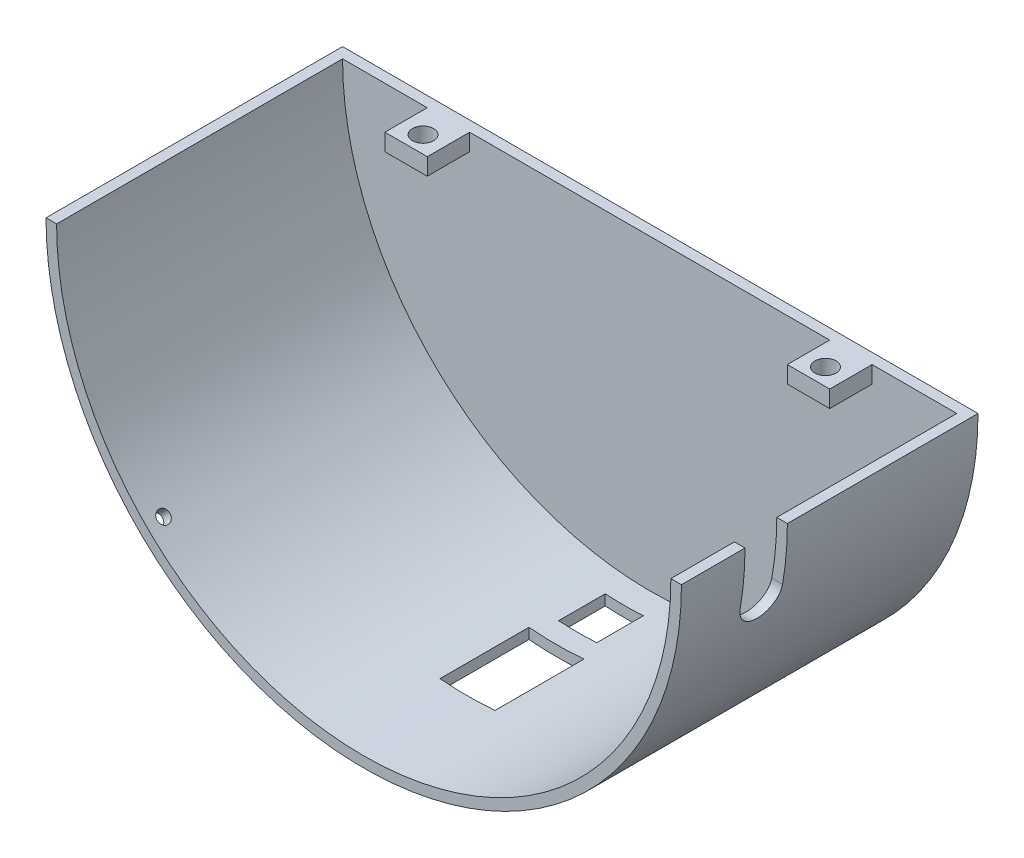
from build123d import *

# Parameters (mm, degrees)
SZKIC1_R                         = 75
DODANIE_WYCI_GNI_CIE1_DEPTH      = 70
SKORUPA1_T                       = -2.5
SZKIC3_W                         = 13
SZKIC3_H                         = 21
WYTNIJ_WYCI_GNI_CIE1_DEPTH       = 60
SZKIC4_W                         = 9
SZKIC4_H                         = 11
WYTNIJ_WYCI_GNI_CIE2_DEPTH       = 60
DODANIE_WYCI_GNI_CIE2_REACH      = 192.066
DODANIE_WYCI_GNI_CIE2_END_RADIUS = 75
SZKIC7_W                         = 60
SZKIC7_H                         = 35
SZKIC8_W                         = 45.5
SZKIC8_H                         = 26.5
WYTNIJ_WYCI_GNI_CIE4_DEPTH       = 30
ZAOKR_GLENIE1_R                  = 5
WYTNIJ_WYCI_GNI_CIE5_DEPTH       = 14
SZKIC10_R                        = 1.5
WYTNIJ_WYCI_GNI_CIE6_DEPTH       = 10
SZYK_KO_OWY1_COUNT               = 4
PRZECI_CIE2_OUTLINE_W            = 152
PRZECI_CIE2_OUTLINE_H            = 70
PRZECI_CIE2_OUTLINE_W_2          = 45.5
PRZECI_CIE2_OUTLINE_H_2          = 26.5
PRZECI_CIE2_DEPTH                = 85
SZKIC11_W                        = 10
SZKIC11_H                        = 10
SZKIC11_R                        = 2.5
DODANIE_WYCI_GNI_CIE3_DEPTH      = 4


# Read off the part's stored shape, not the designer's step: Przecięcie2
with BuildPart() as part:
    # Szkic1 → Dodanie-wyciągnięcie1 (new body)
    with BuildSketch(Plane.XY):
        Circle(SZKIC1_R)
    extrude(amount=DODANIE_WYCI_GNI_CIE1_DEPTH)

    # Skorupa1
    skorupa1_openings = [part.faces().sort_by_distance(p)[0] for p in [
        (0, 0, 70),
    ]]
    offset(amount=SKORUPA1_T, openings=skorupa1_openings, kind=Kind.INTERSECTION)

    # Szkic3 → Wytnij-wyciągnięcie1 (cut)
    with BuildSketch(Plane(origin=(0, -75, 0), x_dir=(-1, 0, 0), z_dir=(0, -1, 0))):
        with Locations((0, -35)):
            Rectangle(SZKIC3_W, SZKIC3_H)
    extrude(amount=-WYTNIJ_WYCI_GNI_CIE1_DEPTH, mode=Mode.SUBTRACT)

    # Szkic4 → Wytnij-wyciągnięcie2 (cut)
    with BuildSketch(Plane(origin=(0, -75, 0), x_dir=(-1, 0, 0), z_dir=(0, -1, 0))):
        with Locations((0, -14)):
            Rectangle(SZKIC4_W, SZKIC4_H)
    extrude(amount=-WYTNIJ_WYCI_GNI_CIE2_DEPTH, mode=Mode.SUBTRACT)

    # Dodanie-wyciągnięcie2: up to this cylinder (the profile starts outside it)
    dodanie_wyci_gni_cie2_end = Plane(origin=(0, 0, 35.532003), z_dir=(0, 0, -1)) * Cylinder(DODANIE_WYCI_GNI_CIE2_END_RADIUS, 535.132, mode=Mode.PRIVATE)
    # Szkic7 → Dodanie-wyciągnięcie2 (add, up to the surface)
    with BuildSketch(Plane(origin=(0, 85, 0), x_dir=(-1, 0, 0), z_dir=(0, -1, 0)), mode=Mode.PRIVATE) as dodanie_wyci_gni_cie2_sk1:
        with Locations((0, -35.532003496)):
            Rectangle(SZKIC7_W, SZKIC7_H)
    dodanie_wyci_gni_cie2_tool1 = extrude(dodanie_wyci_gni_cie2_sk1.sketch, amount=DODANIE_WYCI_GNI_CIE2_REACH, mode=Mode.PRIVATE) - dodanie_wyci_gni_cie2_end
    add(dodanie_wyci_gni_cie2_tool1.solids().sort_by_distance((0, 85, 35.532003))[0])

    # Szkic8 → Wytnij-wyciągnięcie4 (cut)
    with BuildSketch(Plane(origin=(0, 85, 0), x_dir=(1, 0, 0), z_dir=(0, 1, 0))):
        with Locations((0, -35.532003496)):
            Rectangle(SZKIC8_W, SZKIC8_H)
    extrude(amount=-WYTNIJ_WYCI_GNI_CIE4_DEPTH, mode=Mode.SUBTRACT)

    # Zaokrąglenie1
    zaokr_glenie1_edges = [part.edges().sort_by_distance(p)[0] for p in [
        (-30, 76.869317712, 18.032003496),
        (-30, 76.869317712, 53.032003496),
        (30, 76.869317712, 18.032003496),
        (30, 76.869317712, 53.032003496),
    ]]
    fillet(zaokr_glenie1_edges, radius=ZAOKR_GLENIE1_R)

    # Szkic9 → Wytnij-wyciągnięcie5 (cut)
    with BuildSketch(Plane(origin=(75, 0, 0), x_dir=(0, 0, -1), z_dir=(1, 0, 0))):
        with BuildLine():
            Line((-55, -12.979686846), (-55, 12.020313154))
            ThreePointArc((-55, 12.020313154), (-50, 17.020313154), (-45, 12.020313154))
            Line((-45, 12.020313154), (-45, -12.979686846))
            ThreePointArc((-45, -12.979686846), (-50, -17.979686846), (-55, -12.979686846))
        make_face()
    extrude(amount=-WYTNIJ_WYCI_GNI_CIE5_DEPTH, mode=Mode.SUBTRACT)

    # Szkic10 → Wytnij-wyciągnięcie6 (cut)
    with BuildSketch(Plane(origin=(53.033008589, 53.033008589, 0), x_dir=(0, 0, -1), z_dir=(0.7071067811865512, 0.7071067811865438, 0))):
        with Locations(Location((-66, 0, 0), (0, 0, 90))):
            Circle(SZKIC10_R)
    wytnij_wyci_gni_cie6 = extrude(amount=-WYTNIJ_WYCI_GNI_CIE6_DEPTH, mode=Mode.SUBTRACT)

    # Szyk kołowy1: Wytnij-wyciągnięcie6 ×4 about axis
    szyk_ko_owy1_axis = Axis((0, 0, 70), (0, 0, -1))
    for i in range(1, SZYK_KO_OWY1_COUNT):
        add(wytnij_wyci_gni_cie6.rotate(szyk_ko_owy1_axis, i * 360 / SZYK_KO_OWY1_COUNT), mode=Mode.SUBTRACT)

    # Przecięcie2 outline → Przecięcie2 (cut)
    with BuildSketch(Plane(origin=(0, 0, 0), x_dir=(1, 0, 0), z_dir=(0, 1, 0))):
        with Locations((0, -35)):
            Rectangle(PRZECI_CIE2_OUTLINE_W, PRZECI_CIE2_OUTLINE_H)
        with Locations((0, -35.532003496)):
            Rectangle(PRZECI_CIE2_OUTLINE_W_2, PRZECI_CIE2_OUTLINE_H_2, mode=Mode.SUBTRACT)
    extrude(amount=PRZECI_CIE2_DEPTH, mode=Mode.SUBTRACT)

    # Szkic11 → Dodanie-wyciągnięcie3 (add)
    # profile 1 of 2: a face of its own
    with BuildSketch(Plane(origin=(0, 0, 0), x_dir=(1, 0, 0), z_dir=(0, 1, 0))):
        with Locations((47.5, -7.5)):
            Rectangle(SZKIC11_W, SZKIC11_H)
        with Locations(Location((47.5, -8.5, 0), (0, 0, 270))):
            Circle(SZKIC11_R, mode=Mode.SUBTRACT)
    # profile 2 of 2: a face of its own
    with BuildSketch(Plane(origin=(0, 0, 0), x_dir=(1, 0, 0), z_dir=(0, 1, 0))):
        with Locations((-47.5, -7.5)):
            Rectangle(SZKIC11_W, SZKIC11_H)
        with Locations(Location((-47.5, -8.5, 0), (0, 0, 270))):
            Circle(SZKIC11_R, mode=Mode.SUBTRACT)
    extrude(amount=-DODANIE_WYCI_GNI_CIE3_DEPTH)


solid = part.part
